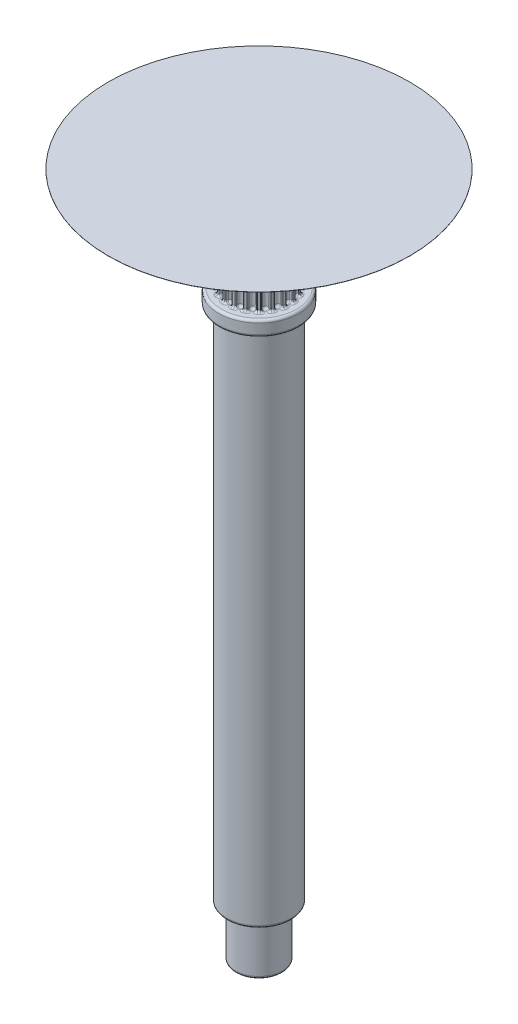
from build123d import *

# Parameters (mm, degrees)
ADAFRUIT_ALUMINUM_GT2_TIMING_PULLEY_6M_DEPTH = 7.4
SKETCH3_R                                    = 8
BOSS_EXTRUDE5_DEPTH                          = 3
BOSS_EXTRUDE7_START                          = -10.4
SKETCH3_2_R                                  = 8
BOSS_EXTRUDE7_DEPTH                          = 3
SKETCH1_R                                    = 6.425
BOSS_EXTRUDE1_DEPTH                          = 103
SKETCH4_R                                    = 4.65
BOSS_EXTRUDE6_DEPTH                          = 10
BOSS_EXTRUDE8_START                          = -126.4
SKETCH4_3_R                                  = 4.65
BOSS_EXTRUDE8_DEPTH                          = 10
FILLET1_R                                    = 0.5
SKETCH5_R                                    = 30
BOSS_EXTRUDE9_DEPTH                          = 0.03


# Read off the part's stored shape, not the designer's step: Adafruit Aluminum GT2 Timing Pulley - 6mm Belt - 20 Tooth - 5mm Bore (Teeth Only)
with BuildPart() as part:
    # Adafruit Aluminum GT2 Timing Pulley  2 → Adafruit Aluminum GT2 Timing Pulley - 6m (new body)
    with BuildSketch(Plane(origin=(0, 0, 0), x_dir=(1, 0, 0), z_dir=(0, 1, 0))):
        with BuildLine():
            ThreePointArc((-4.171664646, 4.450529641), (-4.313351365, 4.313351365), (-4.450529641, 4.171664646))
            ThreePointArc((-4.450529641, 4.171664646), (-4.491023732, 4.064611454), (-4.444222249, 3.960161568))
            ThreePointArc((-4.444222249, 3.960161568), (-4.336160317, 3.839832706), (-4.248908631, 3.703657967))
            ThreePointArc((-4.248908631, 3.703657967), (-4.289891144, 3.116788357), (-4.835373018, 2.896458988))
            ThreePointArc((-4.835373018, 2.896458988), (-4.991845144, 2.937359964), (-5.139677666, 3.002949305))
            ThreePointArc((-5.139677666, 3.002949305), (-5.253477864, 3.01518337), (-5.342778138, 2.943589946))
            ThreePointArc((-5.342778138, 2.943589946), (-5.435139798, 2.769342049), (-5.521820486, 2.592199552))
            ThreePointArc((-5.521820486, 2.592199552), (-5.527251399, 2.477872554), (-5.450463754, 2.392997263))
            ThreePointArc((-5.450463754, 2.392997263), (-5.310507087, 2.311950687), (-5.185445494, 2.209403069))
            ThreePointArc((-5.185445494, 2.209403069), (-5.043069496, 1.638592609), (-5.493768068, 1.260483758))
            ThreePointArc((-5.493768068, 1.260483758), (-5.655221, 1.251030352), (-5.816086304, 1.26772676))
            ThreePointArc((-5.816086304, 1.26772676), (-5.928097258, 1.244195853), (-5.990903281, 1.148511157))
            ThreePointArc((-5.990903281, 1.148511157), (-6.024898878, 0.954250236), (-6.05259707, 0.758991905))
            ThreePointArc((-6.05259707, 0.758991905), (-6.02243319, 0.648582224), (-5.923175892, 0.591589713))
            ThreePointArc((-5.923175892, 0.591589713), (-5.765024422, 0.557758828), (-5.614394822, 0.498876404))
            ThreePointArc((-5.614394822, 0.498876404), (-5.30259707, 0), (-5.614394822, -0.498876404))
            ThreePointArc((-5.614394822, -0.498876404), (-5.765024422, -0.557758828), (-5.923175892, -0.591589713))
            ThreePointArc((-5.923175892, -0.591589713), (-6.02243319, -0.648582224), (-6.05259707, -0.758991905))
            ThreePointArc((-6.05259707, -0.758991905), (-6.024898878, -0.954250236), (-5.990903281, -1.148511157))
            ThreePointArc((-5.990903281, -1.148511157), (-5.928097258, -1.244195853), (-5.816086304, -1.26772676))
            ThreePointArc((-5.816086304, -1.26772676), (-5.655221, -1.251030352), (-5.493768068, -1.260483758))
            ThreePointArc((-5.493768068, -1.260483758), (-5.043069496, -1.638592609), (-5.185445494, -2.209403069))
            ThreePointArc((-5.185445494, -2.209403069), (-5.310507087, -2.311950687), (-5.450463754, -2.392997263))
            ThreePointArc((-5.450463754, -2.392997263), (-5.527251399, -2.477872554), (-5.521820486, -2.592199552))
            ThreePointArc((-5.521820486, -2.592199552), (-5.435139798, -2.769342049), (-5.342778138, -2.943589946))
            ThreePointArc((-5.342778138, -2.943589946), (-5.253477864, -3.01518337), (-5.139677666, -3.002949305))
            ThreePointArc((-5.139677666, -3.002949305), (-4.991845144, -2.937359964), (-4.835373018, -2.896458988))
            ThreePointArc((-4.835373018, -2.896458988), (-4.289891144, -3.116788357), (-4.248908631, -3.703657967))
            ThreePointArc((-4.248908631, -3.703657967), (-4.336160317, -3.839832706), (-4.444222249, -3.960161568))
            ThreePointArc((-4.444222249, -3.960161568), (-4.491023732, -4.064611454), (-4.450529641, -4.171664646))
            ThreePointArc((-4.450529641, -4.171664646), (-4.313351365, -4.313351365), (-4.171664646, -4.450529641))
            ThreePointArc((-4.171664646, -4.450529641), (-4.064611454, -4.491023732), (-3.960161568, -4.444222249))
            ThreePointArc((-3.960161568, -4.444222249), (-3.839832706, -4.336160317), (-3.703657967, -4.248908631))
            ThreePointArc((-3.703657967, -4.248908631), (-3.116788357, -4.289891144), (-2.896458988, -4.835373018))
            ThreePointArc((-2.896458988, -4.835373018), (-2.937359964, -4.991845144), (-3.002949305, -5.139677666))
            ThreePointArc((-3.002949305, -5.139677666), (-3.01518337, -5.253477864), (-2.943589946, -5.342778138))
            ThreePointArc((-2.943589946, -5.342778138), (-2.769342049, -5.435139798), (-2.592199552, -5.521820486))
            ThreePointArc((-2.592199552, -5.521820486), (-2.477872554, -5.527251399), (-2.392997263, -5.450463754))
            ThreePointArc((-2.392997263, -5.450463754), (-2.311950687, -5.310507087), (-2.209403069, -5.185445494))
            ThreePointArc((-2.209403069, -5.185445494), (-1.638592609, -5.043069496), (-1.260483758, -5.493768068))
            ThreePointArc((-1.260483758, -5.493768068), (-1.251030352, -5.655221), (-1.26772676, -5.816086304))
            ThreePointArc((-1.26772676, -5.816086304), (-1.244195853, -5.928097258), (-1.148511157, -5.990903281))
            ThreePointArc((-1.148511157, -5.990903281), (-0.954250236, -6.024898878), (-0.758991905, -6.05259707))
            ThreePointArc((-0.758991905, -6.05259707), (-0.648582224, -6.02243319), (-0.591589713, -5.923175892))
            ThreePointArc((-0.591589713, -5.923175892), (-0.557758828, -5.765024422), (-0.498876404, -5.614394822))
            ThreePointArc((-0.498876404, -5.614394822), (0, -5.30259707), (0.498876404, -5.614394822))
            ThreePointArc((0.498876404, -5.614394822), (0.557758828, -5.765024422), (0.591589713, -5.923175892))
            ThreePointArc((0.591589713, -5.923175892), (0.648582224, -6.02243319), (0.758991905, -6.05259707))
            ThreePointArc((0.758991905, -6.05259707), (0.954250236, -6.024898878), (1.148511157, -5.990903281))
            ThreePointArc((1.148511157, -5.990903281), (1.244195853, -5.928097258), (1.26772676, -5.816086304))
            ThreePointArc((1.26772676, -5.816086304), (1.251030352, -5.655221), (1.260483758, -5.493768068))
            ThreePointArc((1.260483758, -5.493768068), (1.638592609, -5.043069496), (2.209403069, -5.185445494))
            ThreePointArc((2.209403069, -5.185445494), (2.311950687, -5.310507087), (2.392997263, -5.450463754))
            ThreePointArc((2.392997263, -5.450463754), (2.477872554, -5.527251399), (2.592199552, -5.521820486))
            ThreePointArc((2.592199552, -5.521820486), (2.769342049, -5.435139798), (2.943589946, -5.342778138))
            ThreePointArc((2.943589946, -5.342778138), (3.01518337, -5.253477864), (3.002949305, -5.139677666))
            ThreePointArc((3.002949305, -5.139677666), (2.937359964, -4.991845144), (2.896458988, -4.835373018))
            ThreePointArc((2.896458988, -4.835373018), (3.116788357, -4.289891144), (3.703657967, -4.248908631))
            ThreePointArc((3.703657967, -4.248908631), (3.839832706, -4.336160317), (3.960161568, -4.444222249))
            ThreePointArc((3.960161568, -4.444222249), (4.064611454, -4.491023732), (4.171664646, -4.450529641))
            ThreePointArc((4.171664646, -4.450529641), (4.313351365, -4.313351365), (4.450529641, -4.171664646))
            ThreePointArc((4.450529641, -4.171664646), (4.491023732, -4.064611454), (4.444222249, -3.960161568))
            ThreePointArc((4.444222249, -3.960161568), (4.336160317, -3.839832706), (4.248908631, -3.703657967))
            ThreePointArc((4.248908631, -3.703657967), (4.289891144, -3.116788357), (4.835373018, -2.896458988))
            ThreePointArc((4.835373018, -2.896458988), (4.991845144, -2.937359964), (5.139677666, -3.002949305))
            ThreePointArc((5.139677666, -3.002949305), (5.253477864, -3.01518337), (5.342778138, -2.943589946))
            ThreePointArc((5.342778138, -2.943589946), (5.435139798, -2.769342049), (5.521820486, -2.592199552))
            ThreePointArc((5.521820486, -2.592199552), (5.527251399, -2.477872554), (5.450463754, -2.392997263))
            ThreePointArc((5.450463754, -2.392997263), (5.310507087, -2.311950687), (5.185445494, -2.209403069))
            ThreePointArc((5.185445494, -2.209403069), (5.043069496, -1.638592609), (5.493768068, -1.260483758))
            ThreePointArc((5.493768068, -1.260483758), (5.655221, -1.251030352), (5.816086304, -1.26772676))
            ThreePointArc((5.816086304, -1.26772676), (5.928097258, -1.244195853), (5.990903281, -1.148511157))
            ThreePointArc((5.990903281, -1.148511157), (6.024898878, -0.954250236), (6.05259707, -0.758991905))
            ThreePointArc((6.05259707, -0.758991905), (6.02243319, -0.648582224), (5.923175892, -0.591589713))
            ThreePointArc((5.923175892, -0.591589713), (5.765024422, -0.557758828), (5.614394822, -0.498876404))
            ThreePointArc((5.614394822, -0.498876404), (5.30259707, 0), (5.614394822, 0.498876404))
            ThreePointArc((5.614394822, 0.498876404), (5.765024422, 0.557758828), (5.923175892, 0.591589713))
            ThreePointArc((5.923175892, 0.591589713), (6.02243319, 0.648582224), (6.05259707, 0.758991905))
            ThreePointArc((6.05259707, 0.758991905), (6.024898878, 0.954250236), (5.990903281, 1.148511157))
            ThreePointArc((5.990903281, 1.148511157), (5.928097258, 1.244195853), (5.816086304, 1.26772676))
            ThreePointArc((5.816086304, 1.26772676), (5.655221, 1.251030352), (5.493768068, 1.260483758))
            ThreePointArc((5.493768068, 1.260483758), (5.043069496, 1.638592609), (5.185445494, 2.209403069))
            ThreePointArc((5.185445494, 2.209403069), (5.310507087, 2.311950687), (5.450463754, 2.392997263))
            ThreePointArc((5.450463754, 2.392997263), (5.527251399, 2.477872554), (5.521820486, 2.592199552))
            ThreePointArc((5.521820486, 2.592199552), (5.435139798, 2.769342049), (5.342778138, 2.943589946))
            ThreePointArc((5.342778138, 2.943589946), (5.253477864, 3.01518337), (5.139677666, 3.002949305))
            ThreePointArc((5.139677666, 3.002949305), (4.991845144, 2.937359964), (4.835373018, 2.896458988))
            ThreePointArc((4.835373018, 2.896458988), (4.289891144, 3.116788357), (4.248908631, 3.703657967))
            ThreePointArc((4.248908631, 3.703657967), (4.336160317, 3.839832706), (4.444222249, 3.960161568))
            ThreePointArc((4.444222249, 3.960161568), (4.491023732, 4.064611454), (4.450529641, 4.171664646))
            ThreePointArc((4.450529641, 4.171664646), (4.313351365, 4.313351365), (4.171664646, 4.450529641))
            ThreePointArc((4.171664646, 4.450529641), (4.064611454, 4.491023732), (3.960161568, 4.444222249))
            ThreePointArc((3.960161568, 4.444222249), (3.839832706, 4.336160317), (3.703657967, 4.248908631))
            ThreePointArc((3.703657967, 4.248908631), (3.116788357, 4.289891144), (2.896458988, 4.835373018))
            ThreePointArc((2.896458988, 4.835373018), (2.937359964, 4.991845144), (3.002949305, 5.139677666))
            ThreePointArc((3.002949305, 5.139677666), (3.01518337, 5.253477864), (2.943589946, 5.342778138))
            ThreePointArc((2.943589946, 5.342778138), (2.769342049, 5.435139798), (2.592199552, 5.521820486))
            ThreePointArc((2.592199552, 5.521820486), (2.477872554, 5.527251399), (2.392997263, 5.450463754))
            ThreePointArc((2.392997263, 5.450463754), (2.311950687, 5.310507087), (2.209403069, 5.185445494))
            ThreePointArc((2.209403069, 5.185445494), (1.638592609, 5.043069496), (1.260483758, 5.493768068))
            ThreePointArc((1.260483758, 5.493768068), (1.251030352, 5.655221), (1.26772676, 5.816086304))
            ThreePointArc((1.26772676, 5.816086304), (1.244195853, 5.928097258), (1.148511157, 5.990903281))
            ThreePointArc((1.148511157, 5.990903281), (0.954250236, 6.024898878), (0.758991905, 6.05259707))
            ThreePointArc((0.758991905, 6.05259707), (0.648582224, 6.02243319), (0.591589713, 5.923175892))
            ThreePointArc((0.591589713, 5.923175892), (0.557758828, 5.765024422), (0.498876404, 5.614394822))
            ThreePointArc((0.498876404, 5.614394822), (0, 5.30259707), (-0.498876404, 5.614394822))
            ThreePointArc((-0.498876404, 5.614394822), (-0.557758828, 5.765024422), (-0.591589713, 5.923175892))
            ThreePointArc((-0.591589713, 5.923175892), (-0.648582224, 6.02243319), (-0.758991905, 6.05259707))
            ThreePointArc((-0.758991905, 6.05259707), (-0.954250236, 6.024898878), (-1.148511157, 5.990903281))
            ThreePointArc((-1.148511157, 5.990903281), (-1.244195853, 5.928097258), (-1.26772676, 5.816086304))
            ThreePointArc((-1.26772676, 5.816086304), (-1.251030352, 5.655221), (-1.260483758, 5.493768068))
            ThreePointArc((-1.260483758, 5.493768068), (-1.638592609, 5.043069496), (-2.209403069, 5.185445494))
            ThreePointArc((-2.209403069, 5.185445494), (-2.311950687, 5.310507087), (-2.392997263, 5.450463754))
            ThreePointArc((-2.392997263, 5.450463754), (-2.477872554, 5.527251399), (-2.592199552, 5.521820486))
            ThreePointArc((-2.592199552, 5.521820486), (-2.769342049, 5.435139798), (-2.943589946, 5.342778138))
            ThreePointArc((-2.943589946, 5.342778138), (-3.01518337, 5.253477864), (-3.002949305, 5.139677666))
            ThreePointArc((-3.002949305, 5.139677666), (-2.937359964, 4.991845144), (-2.896458988, 4.835373018))
            ThreePointArc((-2.896458988, 4.835373018), (-3.116788357, 4.289891144), (-3.703657967, 4.248908631))
            ThreePointArc((-3.703657967, 4.248908631), (-3.839832706, 4.336160317), (-3.960161568, 4.444222249))
            ThreePointArc((-3.960161568, 4.444222249), (-4.064611454, 4.491023732), (-4.171664646, 4.450529641))
        make_face()
    extrude(amount=ADAFRUIT_ALUMINUM_GT2_TIMING_PULLEY_6M_DEPTH)

    # Sketch3 → Boss-Extrude5 (add)
    with BuildSketch(Plane.XZ):
        with Locations(Location((0, 0, 0), (0, 0, 270))):
            Circle(SKETCH3_R)
    extrude(amount=BOSS_EXTRUDE5_DEPTH)

    # Sketch3<2> → Boss-Extrude7 (add)
    with BuildSketch(Plane.XZ.offset(BOSS_EXTRUDE7_START)):
        with Locations(Location((0, 0, 0), (0, 0, 270))):
            Circle(SKETCH3_2_R)
    extrude(amount=BOSS_EXTRUDE7_DEPTH)

    # Sketch1 → Boss-Extrude1 (add)
    with BuildSketch(Plane(origin=(0, -3, 0), x_dir=(1, 0, 0), z_dir=(0, 1, 0))):
        with Locations(Location((0, 0, 0), (0, 0, 90))):
            Circle(SKETCH1_R)
    extrude(amount=-BOSS_EXTRUDE1_DEPTH)

    # Sketch4 → Boss-Extrude6 (add)
    with BuildSketch(Plane.XZ.offset(106)):
        with Locations(Location((0, 0, 0), (0, 0, 270))):
            Circle(SKETCH4_R)
    extrude(amount=BOSS_EXTRUDE6_DEPTH)

    # Sketch4<3> → Boss-Extrude8 (add)
    with BuildSketch(Plane.XZ.offset(106).offset(BOSS_EXTRUDE8_START)):
        with Locations(Location((0, 0, 0), (0, 0, 270))):
            Circle(SKETCH4_3_R)
    extrude(amount=BOSS_EXTRUDE8_DEPTH)

    # Fillet1
    fillet1_edges = [part.edges().sort_by_distance(p)[0] for p in [
        (-0.557758828, 0, -5.765024422),
        (-0.557758828, 7.4, -5.765024422),
        (-0.648582224, 0, -6.02243319),
        (-0.648582224, 7.4, -6.02243319),
        (0, 7.4, -5.30259707),
        (0.557758828, 7.4, -5.765024422),
        (0.648582224, 7.4, -6.02243319),
        (0, 0, -5.30259707),
        (0.648582224, 0, -6.02243319),
        (0.557758828, 0, -5.765024422),
        (-3.839832706, 0, -4.336160317),
        (-3.839832706, 7.4, -4.336160317),
        (-4.064611454, 0, -4.491023732),
        (-4.064611454, 7.4, -4.491023732),
        (-3.116788357, 7.4, -4.289891144),
        (-2.937359964, 7.4, -4.991845144),
        (-3.01518337, 7.4, -5.253477864),
        (-3.116788357, 0, -4.289891144),
        (-3.01518337, 0, -5.253477864),
        (-2.937359964, 0, -4.991845144),
        (-4.991845144, 0, -2.937359964),
        (-4.991845144, 7.4, -2.937359964),
        (-5.253477864, 0, -3.01518337),
        (-5.253477864, 7.4, -3.01518337),
        (-4.289891144, 7.4, -3.116788357),
        (-4.336160317, 7.4, -3.839832706),
        (-4.491023732, 7.4, -4.064611454),
        (-4.289891144, 0, -3.116788357),
        (-4.491023732, 0, -4.064611454),
        (-4.336160317, 0, -3.839832706),
        (-5.655221, 0, -1.251030352),
        (-5.655221, 7.4, -1.251030352),
        (-5.928097258, 0, -1.244195853),
        (-5.928097258, 7.4, -1.244195853),
        (-5.043069496, 7.4, -1.638592609),
        (-5.310507087, 7.4, -2.311950687),
        (-5.527251399, 7.4, -2.477872554),
        (-5.043069496, 0, -1.638592609),
        (-5.527251399, 0, -2.477872554),
        (-5.310507087, 0, -2.311950687),
        (-5.765024422, 0, 0.557758828),
        (-5.765024422, 7.4, 0.557758828),
        (-6.02243319, 0, 0.648582224),
        (-6.02243319, 7.4, 0.648582224),
        (-5.30259707, 7.4, 0),
        (-5.765024422, 7.4, -0.557758828),
        (-6.02243319, 7.4, -0.648582224),
        (-5.30259707, 0, 0),
        (-6.02243319, 0, -0.648582224),
        (-5.765024422, 0, -0.557758828),
        (-5.310507087, 0, 2.311950687),
        (-5.310507087, 7.4, 2.311950687),
        (-5.527251399, 0, 2.477872554),
        (-5.527251399, 7.4, 2.477872554),
        (-5.043069496, 7.4, 1.638592609),
        (-5.655221, 7.4, 1.251030352),
        (-5.928097258, 7.4, 1.244195853),
        (-5.043069496, 0, 1.638592609),
        (-5.928097258, 0, 1.244195853),
        (-5.655221, 0, 1.251030352),
        (-4.336160317, 0, 3.839832706),
        (-4.336160317, 7.4, 3.839832706),
        (-4.491023732, 0, 4.064611454),
        (-4.491023732, 7.4, 4.064611454),
        (-4.289891144, 7.4, 3.116788357),
        (-4.991845144, 7.4, 2.937359964),
        (-5.253477864, 7.4, 3.01518337),
        (-4.289891144, 0, 3.116788357),
        (-5.253477864, 0, 3.01518337),
        (-4.991845144, 0, 2.937359964),
        (-2.937359964, 0, 4.991845144),
        (-2.937359964, 7.4, 4.991845144),
        (-3.01518337, 0, 5.253477864),
        (-3.01518337, 7.4, 5.253477864),
        (-3.116788357, 7.4, 4.289891144),
        (-3.839832706, 7.4, 4.336160317),
        (-4.064611454, 7.4, 4.491023732),
        (-3.116788357, 0, 4.289891144),
        (-4.064611454, 0, 4.491023732),
        (-3.839832706, 0, 4.336160317),
        (-1.251030352, 0, 5.655221),
        (-1.251030352, 7.4, 5.655221),
        (-1.244195853, 0, 5.928097258),
        (-1.244195853, 7.4, 5.928097258),
        (-1.638592609, 7.4, 5.043069496),
        (-2.311950687, 7.4, 5.310507087),
        (-2.477872554, 7.4, 5.527251399),
        (-1.638592609, 0, 5.043069496),
        (-2.477872554, 0, 5.527251399),
        (-2.311950687, 0, 5.310507087),
        (0.557758828, 0, 5.765024422),
        (0.557758828, 7.4, 5.765024422),
        (0.648582224, 0, 6.02243319),
        (0.648582224, 7.4, 6.02243319),
        (0, 7.4, 5.30259707),
        (-0.557758828, 7.4, 5.765024422),
        (-0.648582224, 7.4, 6.02243319),
        (0, 0, 5.30259707),
        (-0.648582224, 0, 6.02243319),
        (-0.557758828, 0, 5.765024422),
        (2.311950687, 0, 5.310507087),
        (2.311950687, 7.4, 5.310507087),
        (2.477872554, 0, 5.527251399),
        (2.477872554, 7.4, 5.527251399),
        (1.638592609, 7.4, 5.043069496),
        (1.251030352, 7.4, 5.655221),
        (1.244195853, 7.4, 5.928097258),
        (1.638592609, 0, 5.043069496),
        (1.244195853, 0, 5.928097258),
        (1.251030352, 0, 5.655221),
        (3.839832706, 0, 4.336160317),
        (3.839832706, 7.4, 4.336160317),
        (4.064611454, 0, 4.491023732),
        (4.064611454, 7.4, 4.491023732),
        (3.116788357, 7.4, 4.289891144),
        (2.937359964, 7.4, 4.991845144),
        (3.01518337, 7.4, 5.253477864),
        (3.116788357, 0, 4.289891144),
        (3.01518337, 0, 5.253477864),
        (2.937359964, 0, 4.991845144),
        (4.991845144, 0, 2.937359964),
        (4.991845144, 7.4, 2.937359964),
        (5.253477864, 0, 3.01518337),
        (5.253477864, 7.4, 3.01518337),
        (4.289891144, 7.4, 3.116788357),
        (4.336160317, 7.4, 3.839832706),
        (4.491023732, 7.4, 4.064611454),
        (4.289891144, 0, 3.116788357),
        (4.491023732, 0, 4.064611454),
        (4.336160317, 0, 3.839832706),
        (5.655221, 0, 1.251030352),
        (5.655221, 7.4, 1.251030352),
        (5.928097258, 0, 1.244195853),
        (5.928097258, 7.4, 1.244195853),
        (5.043069496, 7.4, 1.638592609),
        (5.310507087, 7.4, 2.311950687),
        (5.527251399, 7.4, 2.477872554),
        (5.043069496, 0, 1.638592609),
        (5.527251399, 0, 2.477872554),
        (5.310507087, 0, 2.311950687),
        (5.765024422, 0, -0.557758828),
        (5.765024422, 7.4, -0.557758828),
        (6.02243319, 0, -0.648582224),
        (6.02243319, 7.4, -0.648582224),
        (5.30259707, 7.4, 0),
        (5.765024422, 7.4, 0.557758828),
        (6.02243319, 7.4, 0.648582224),
        (5.30259707, 0, 0),
        (6.02243319, 0, 0.648582224),
        (5.765024422, 0, 0.557758828),
        (5.310507087, 0, -2.311950687),
        (5.310507087, 7.4, -2.311950687),
        (5.527251399, 0, -2.477872554),
        (5.527251399, 7.4, -2.477872554),
        (5.043069496, 7.4, -1.638592609),
        (5.655221, 7.4, -1.251030352),
        (-2.769342049, 0, -5.435139798),
        (5.928097258, 7.4, -1.244195853),
        (5.043069496, 0, -1.638592609),
        (5.928097258, 0, -1.244195853),
        (5.655221, 0, -1.251030352),
        (-4.313351365, 0, -4.313351365),
        (4.336160317, 0, -3.839832706),
        (4.336160317, 7.4, -3.839832706),
        (4.491023732, 0, -4.064611454),
        (4.491023732, 7.4, -4.064611454),
        (4.289891144, 7.4, -3.116788357),
        (4.991845144, 7.4, -2.937359964),
        (5.253477864, 7.4, -3.01518337),
        (4.289891144, 0, -3.116788357),
        (5.253477864, 0, -3.01518337),
        (4.991845144, 0, -2.937359964),
        (-5.435139798, 0, -2.769342049),
        (2.937359964, 0, -4.991845144),
        (2.937359964, 7.4, -4.991845144),
        (3.01518337, 0, -5.253477864),
        (3.01518337, 7.4, -5.253477864),
        (3.116788357, 7.4, -4.289891144),
        (3.839832706, 7.4, -4.336160317),
        (4.064611454, 7.4, -4.491023732),
        (3.116788357, 0, -4.289891144),
        (4.064611454, 0, -4.491023732),
        (3.839832706, 0, -4.336160317),
        (-6.024898878, 0, -0.954250236),
        (1.251030352, 0, -5.655221),
        (1.251030352, 7.4, -5.655221),
        (1.244195853, 0, -5.928097258),
        (1.244195853, 7.4, -5.928097258),
        (1.638592609, 7.4, -5.043069496),
        (2.311950687, 7.4, -5.310507087),
        (2.477872554, 7.4, -5.527251399),
        (-6.024898878, 0, 0.954250236),
        (1.638592609, 0, -5.043069496),
        (2.477872554, 0, -5.527251399),
        (2.311950687, 0, -5.310507087),
        (-2.311950687, 0, -5.310507087),
        (-5.435139798, 0, 2.769342049),
        (-2.311950687, 7.4, -5.310507087),
        (-2.477872554, 0, -5.527251399),
        (-2.477872554, 7.4, -5.527251399),
        (-1.638592609, 7.4, -5.043069496),
        (-1.251030352, 7.4, -5.655221),
        (-1.244195853, 7.4, -5.928097258),
        (-1.638592609, 0, -5.043069496),
        (-1.244195853, 0, -5.928097258),
        (-1.251030352, 0, -5.655221),
        (-4.313351365, 0, 4.313351365),
        (-2.769342049, 0, 5.435139798),
        (-0.954250236, 0, 6.024898878),
        (0.954250236, 0, 6.024898878),
        (2.769342049, 0, 5.435139798),
        (4.313351365, 0, 4.313351365),
        (5.435139798, 0, 2.769342049),
        (6.024898878, 0, 0.954250236),
        (6.024898878, 0, -0.954250236),
        (5.435139798, 0, -2.769342049),
        (4.313351365, 0, -4.313351365),
        (2.769342049, 0, -5.435139798),
        (0.954250236, 0, -6.024898878),
        (0, 0, 8),
        (0, -3, 8),
        (0, 7.4, 8),
        (0, 10.4, 8),
        (-0.954250236, 0, -6.024898878),
        (0, -106, 6.425),
        (0, -3, 6.425),
        (0, -106, 4.65),
        (0, -116, 4.65),
        (0, 10.4, 4.65),
        (0, 20.4, 4.65),
        (-2.769342049, 7.4, -5.435139798),
        (-4.313351365, 7.4, -4.313351365),
        (-5.435139798, 7.4, -2.769342049),
        (-6.024898878, 7.4, -0.954250236),
        (-6.024898878, 7.4, 0.954250236),
        (-5.435139798, 7.4, 2.769342049),
        (-4.313351365, 7.4, 4.313351365),
        (-2.769342049, 7.4, 5.435139798),
        (-0.954250236, 7.4, 6.024898878),
        (0.954250236, 7.4, 6.024898878),
        (2.769342049, 7.4, 5.435139798),
        (4.313351365, 7.4, 4.313351365),
        (5.435139798, 7.4, 2.769342049),
        (-0.954250236, 7.4, -6.024898878),
        (6.024898878, 7.4, 0.954250236),
        (6.024898878, 7.4, -0.954250236),
        (5.435139798, 7.4, -2.769342049),
        (4.313351365, 7.4, -4.313351365),
        (2.769342049, 7.4, -5.435139798),
        (0.954250236, 7.4, -6.024898878),
    ]]
    fillet(fillet1_edges, radius=FILLET1_R)

    # Sketch5 → Boss-Extrude9 (add)
    with BuildSketch(Plane(origin=(0, 20.4, 0), x_dir=(1, 0, 0), z_dir=(0, 1, 0))):
        with Locations(Location((0, 0, 0), (0, 0, 270))):
            Circle(SKETCH5_R)
    extrude(amount=BOSS_EXTRUDE9_DEPTH)


solid = part.part
